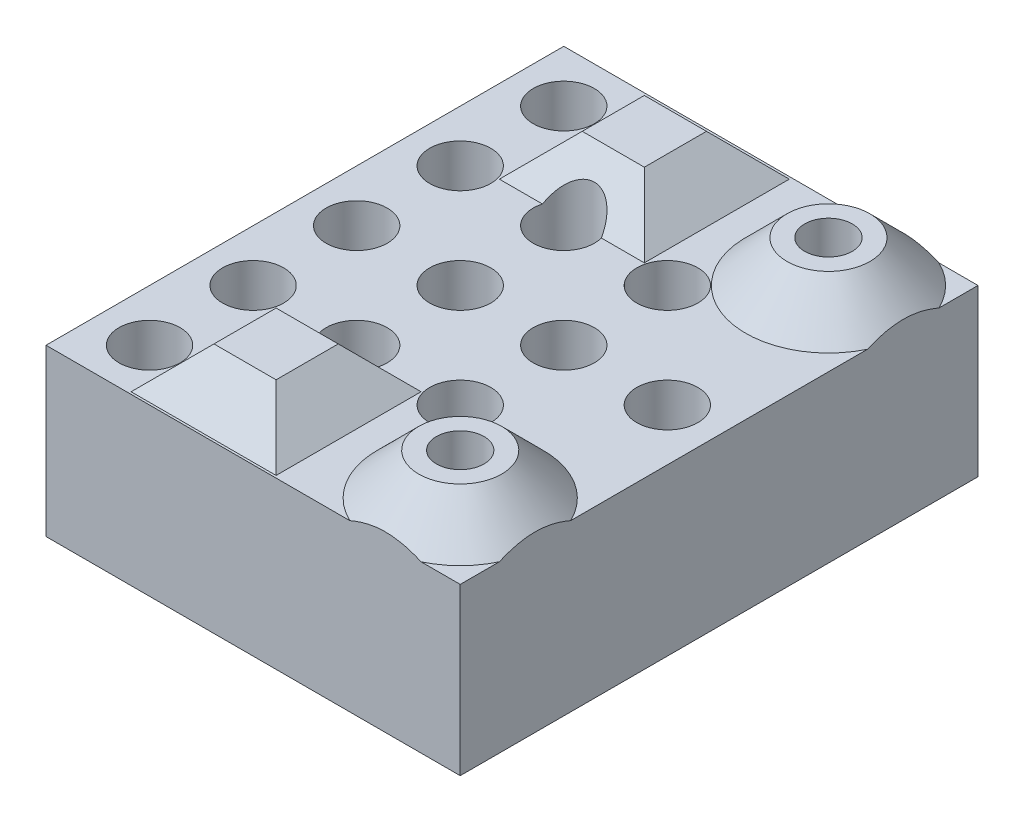
from build123d import *

# Parameters (mm, degrees)
SKETCH1_W                = 25
SKETCH1_H                = 25
BOSS_EXTRUDE1_DEPTH      = 8
SKETCH2_R                = 0.95
CUT_EXTRUDE1_DEPTH       = 20.403607912
BOSS_EXTRUDE2_START      = 2
SKETCH3_R                = 2
SKETCH3_R_2              = 0.95
BOSS_EXTRUDE2_DEPTH      = 2
SKETCH6_W                = 3
SKETCH6_H                = 3
BOSS_EXTRUDE3_DEPTH      = 2
CHAMFER1_SIZE            = 2
SKETCH4_R                = 1.475
CUT_EXTRUDE2_DEPTH       = 21.310096012
LPATTERN1_COUNT          = 5
LPATTERN1_PITCH          = 5
LPATTERN1_COUNT_DIR2     = 3
LPATTERN1_PITCH_DIR2     = 5
MIRROR1_COPY_1_SKETCH_R  = 1.475
MIRROR1_COPY_1_DEPTH     = 21.310096012
MIRROR1_COPY_2_SKETCH_R  = 1.475
MIRROR1_COPY_2_DEPTH     = 21.310096012
MIRROR1_COPY_3_SKETCH_R  = 1.475
MIRROR1_COPY_3_DEPTH     = 21.310096012
MIRROR1_COPY_4_SKETCH_R  = 1.475
MIRROR1_COPY_4_DEPTH     = 21.310096012
MIRROR1_COPY_5_SKETCH_R  = 1.475
MIRROR1_COPY_5_DEPTH     = 21.310096012
MIRROR1_COPY_6_SKETCH_R  = 1.475
MIRROR1_COPY_6_DEPTH     = 21.310096012
MIRROR1_COPY_7_SKETCH_R  = 1.475
MIRROR1_COPY_7_DEPTH     = 21.310096012
MIRROR1_COPY_8_SKETCH_R  = 1.475
MIRROR1_COPY_8_DEPTH     = 21.310096012
MIRROR1_COPY_9_SKETCH_R  = 1.475
MIRROR1_COPY_9_DEPTH     = 21.310096012
MIRROR1_COPY_10_SKETCH_R = 1.475
MIRROR1_COPY_10_DEPTH    = 21.310096012
MIRROR1_COPY_11_SKETCH_R = 1.475
MIRROR1_COPY_11_DEPTH    = 21.310096012
SKETCH5_R                = 1.15
CUT_EXTRUDE3_DEPTH       = 2
SKETCH7_W                = 5
SKETCH7_H                = 25
CUT_EXTRUDE4_DEPTH       = 20.403607912


with BuildPart() as part:
    # Sketch1 → Boss-Extrude1 (new body)
    with BuildSketch(Plane(origin=(0, 0, 0), x_dir=(1, 0, 0), z_dir=(0, 1, 0))):
        Rectangle(SKETCH1_W, SKETCH1_H)
    extrude(amount=BOSS_EXTRUDE1_DEPTH)

    # Sketch2 → Cut-Extrude1 (cut, through all)
    with BuildSketch(Plane(origin=(0, 8, 0), x_dir=(1, 0, 0), z_dir=(0, 1, 0))):
        with Locations(Location((8.89, -8.89, 0), (0, 0, 270))):
            Circle(SKETCH2_R)
        with Locations(Location((8.89, 8.89, 0), (0, 0, 270))):
            Circle(SKETCH2_R)
    extrude(amount=-CUT_EXTRUDE1_DEPTH, mode=Mode.SUBTRACT)

    # Sketch3 → Boss-Extrude2 (add)
    # profile 1 of 2: a face of its own
    with BuildSketch(Plane(origin=(0, 8, 0), x_dir=(1, 0, 0), z_dir=(0, 1, 0)).offset(BOSS_EXTRUDE2_START)):
        with Locations(Location((8.89, 8.89, 0), (0, 0, 270))):
            Circle(SKETCH3_R)
        with Locations(Location((8.89, 8.89, 0), (0, 0, 270))):
            Circle(SKETCH3_R_2, mode=Mode.SUBTRACT)
    # profile 2 of 2: a face of its own
    with BuildSketch(Plane(origin=(0, 8, 0), x_dir=(1, 0, 0), z_dir=(0, 1, 0)).offset(BOSS_EXTRUDE2_START)):
        with Locations(Location((8.89, -8.89, 0), (0, 0, 270))):
            Circle(SKETCH3_R)
        with Locations(Location((8.89, -8.89, 0), (0, 0, 270))):
            Circle(SKETCH3_R_2, mode=Mode.SUBTRACT)
    extrude(amount=-BOSS_EXTRUDE2_DEPTH)

    # Sketch6 → Boss-Extrude3 (add)
    with BuildSketch(Plane(origin=(0, 8, 0), x_dir=(1, 0, 0), z_dir=(0, 1, 0))):
        with Locations((0, 8.89)):
            Rectangle(SKETCH6_W, SKETCH6_H)
        with Locations((0, -8.89)):
            Rectangle(SKETCH6_W, SKETCH6_H)
    extrude(amount=BOSS_EXTRUDE3_DEPTH)

    # Chamfer1
    # the kernel refuses this chamfer: 2 mm, written as the material it adds along each edge
    with BuildSketch(Plane(origin=(8.89, 8, -8.89), x_dir=(0, 0, 1), z_dir=(-1, 0, 0))) as chamfer1_piece_1_section:
        Polygon((2 + CHAMFER1_SIZE, 0), (2, CHAMFER1_SIZE), (2, 0), align=None)
    chamfer1_piece_1 = revolve(axis=Axis((8.89, 8, -8.89), (0, 1, 0)), mode=Mode.PRIVATE)
    chamfer1_piece_1 = split(chamfer1_piece_1, bisect_by=Plane(origin=(8.89, 8.948307197, -12.5), z_dir=(0, 0, 1)), keep=Keep.TOP, mode=Mode.PRIVATE)
    chamfer1_piece_1 = split(chamfer1_piece_1, bisect_by=Plane(origin=(12.5, 8.948307197, -11.894875739), z_dir=(-1, 0, 0)), keep=Keep.TOP, mode=Mode.PRIVATE)
    chamfer1_piece_1 = split(chamfer1_piece_1, bisect_by=Plane(origin=(8.89, 10, -11.894875739), z_dir=(0, -1, 0)), keep=Keep.TOP, mode=Mode.PRIVATE)
    add(chamfer1_piece_1)
    with BuildSketch(Plane(origin=(8.89, 8, 8.89), x_dir=(0, 0, 1), z_dir=(-1, 0, 0))) as chamfer1_piece_2_section:
        Polygon((2 + CHAMFER1_SIZE, 0), (2, CHAMFER1_SIZE), (2, 0), align=None)
    chamfer1_piece_2 = revolve(axis=Axis((8.89, 8, 8.89), (0, 1, 0)), mode=Mode.PRIVATE)
    chamfer1_piece_2 = split(chamfer1_piece_2, bisect_by=Plane(origin=(12.5, 8.948307195, 5.885124263), z_dir=(-1, 0, 0)), keep=Keep.TOP, mode=Mode.PRIVATE)
    chamfer1_piece_2 = split(chamfer1_piece_2, bisect_by=Plane(origin=(8.89, 8.948307195, 12.5), z_dir=(0, 0, -1)), keep=Keep.TOP, mode=Mode.PRIVATE)
    chamfer1_piece_2 = split(chamfer1_piece_2, bisect_by=Plane(origin=(8.89, 10, 5.885124263), z_dir=(0, -1, 0)), keep=Keep.TOP, mode=Mode.PRIVATE)
    add(chamfer1_piece_2)
    with BuildSketch(Plane(origin=(-1.5, 8, 7.39), x_dir=(0, -0.027495876610586487, -0.9996219169112968), z_dir=(1, 0, 0))) as chamfer1_piece_3_section:
        Polygon((CHAMFER1_SIZE * 0.999621916911, CHAMFER1_SIZE * 0.0274958766106), (-CHAMFER1_SIZE * 0.0274958766106, CHAMFER1_SIZE * 0.999621916911), (0, 0), align=None)
    chamfer1_piece_3 = extrude(amount=3, mode=Mode.PRIVATE)
    chamfer1_piece_3 = split(chamfer1_piece_3, bisect_by=Plane(origin=(0, 10, 6.729191691), z_dir=(0, -1, 0)), keep=Keep.TOP, mode=Mode.PRIVATE)
    add(chamfer1_piece_3)
    with BuildSketch(Plane(origin=(1.5, 8, 7.39), x_dir=(0.9996219169112968, -0.027495876610586494, 0), z_dir=(0, 0, 1))) as chamfer1_piece_4_section:
        Polygon((CHAMFER1_SIZE * 0.999621916911, CHAMFER1_SIZE * 0.0274958766106), (-CHAMFER1_SIZE * 0.0274958766106, CHAMFER1_SIZE * 0.999621916911), (0, 0), align=None)
    chamfer1_piece_4 = extrude(amount=3, mode=Mode.PRIVATE)
    chamfer1_piece_4 = split(chamfer1_piece_4, bisect_by=Plane(origin=(2.160808309, 10, 8.89), z_dir=(0, -1, 0)), keep=Keep.TOP, mode=Mode.PRIVATE)
    add(chamfer1_piece_4)
    with BuildSketch(Plane(origin=(1.5, 8, 10.39), x_dir=(0, -0.027495876610586487, 0.9996219169112968), z_dir=(-1, 0, 0))) as chamfer1_piece_5_section:
        Polygon((CHAMFER1_SIZE * 0.999621916911, CHAMFER1_SIZE * 0.0274958766106), (-CHAMFER1_SIZE * 0.0274958766106, CHAMFER1_SIZE * 0.999621916911), (0, 0), align=None)
    chamfer1_piece_5 = extrude(amount=3, mode=Mode.PRIVATE)
    chamfer1_piece_5 = split(chamfer1_piece_5, bisect_by=Plane(origin=(0, 10, 11.050808309), z_dir=(0, -1, 0)), keep=Keep.TOP, mode=Mode.PRIVATE)
    add(chamfer1_piece_5)
    with BuildSketch(Plane(origin=(-1.5, 8, 10.39), x_dir=(-0.9996219169112968, -0.027495876610586497, 0), z_dir=(0, 0, -1))) as chamfer1_piece_6_section:
        Polygon((CHAMFER1_SIZE * 0.999621916911, CHAMFER1_SIZE * 0.0274958766106), (-CHAMFER1_SIZE * 0.0274958766106, CHAMFER1_SIZE * 0.999621916911), (0, 0), align=None)
    chamfer1_piece_6 = extrude(amount=3, mode=Mode.PRIVATE)
    chamfer1_piece_6 = split(chamfer1_piece_6, bisect_by=Plane(origin=(-2.160808309, 10, 8.89), z_dir=(0, -1, 0)), keep=Keep.TOP, mode=Mode.PRIVATE)
    add(chamfer1_piece_6)
    with BuildSketch(Plane(origin=(1.5, 8, -10.39), x_dir=(0.9996219169112968, -0.027495876610586494, 0), z_dir=(0, 0, 1))) as chamfer1_piece_7_section:
        Polygon((CHAMFER1_SIZE * 0.999621916911, CHAMFER1_SIZE * 0.0274958766106), (-CHAMFER1_SIZE * 0.0274958766106, CHAMFER1_SIZE * 0.999621916911), (0, 0), align=None)
    chamfer1_piece_7 = extrude(amount=3, mode=Mode.PRIVATE)
    chamfer1_piece_7 = split(chamfer1_piece_7, bisect_by=Plane(origin=(2.160808309, 10, -8.89), z_dir=(0, -1, 0)), keep=Keep.TOP, mode=Mode.PRIVATE)
    add(chamfer1_piece_7)
    with BuildSketch(Plane(origin=(-1.5, 8, -10.39), x_dir=(0, -0.027495876610586487, -0.9996219169112968), z_dir=(1, 0, 0))) as chamfer1_piece_8_section:
        Polygon((CHAMFER1_SIZE * 0.999621916911, CHAMFER1_SIZE * 0.0274958766106), (-CHAMFER1_SIZE * 0.0274958766106, CHAMFER1_SIZE * 0.999621916911), (0, 0), align=None)
    chamfer1_piece_8 = extrude(amount=3, mode=Mode.PRIVATE)
    chamfer1_piece_8 = split(chamfer1_piece_8, bisect_by=Plane(origin=(0, 10, -11.050808309), z_dir=(0, -1, 0)), keep=Keep.TOP, mode=Mode.PRIVATE)
    add(chamfer1_piece_8)
    with BuildSketch(Plane(origin=(-1.5, 8, -7.39), x_dir=(-0.9996219169112968, -0.027495876610586494, 0), z_dir=(0, 0, -1))) as chamfer1_piece_9_section:
        Polygon((CHAMFER1_SIZE * 0.999621916911, CHAMFER1_SIZE * 0.0274958766106), (-CHAMFER1_SIZE * 0.0274958766106, CHAMFER1_SIZE * 0.999621916911), (0, 0), align=None)
    chamfer1_piece_9 = extrude(amount=3, mode=Mode.PRIVATE)
    chamfer1_piece_9 = split(chamfer1_piece_9, bisect_by=Plane(origin=(-2.160808309, 10, -8.89), z_dir=(0, -1, 0)), keep=Keep.TOP, mode=Mode.PRIVATE)
    add(chamfer1_piece_9)
    with BuildSketch(Plane(origin=(1.5, 8, -7.39), x_dir=(0, -0.027495876610586487, 0.9996219169112968), z_dir=(-1, 0, 0))) as chamfer1_piece_10_section:
        Polygon((CHAMFER1_SIZE * 0.999621916911, CHAMFER1_SIZE * 0.0274958766106), (-CHAMFER1_SIZE * 0.0274958766106, CHAMFER1_SIZE * 0.999621916911), (0, 0), align=None)
    chamfer1_piece_10 = extrude(amount=3, mode=Mode.PRIVATE)
    chamfer1_piece_10 = split(chamfer1_piece_10, bisect_by=Plane(origin=(0, 10, -6.729191691), z_dir=(0, -1, 0)), keep=Keep.TOP, mode=Mode.PRIVATE)
    add(chamfer1_piece_10)
    with BuildSketch(Plane(origin=(-6.643365976, 8, 7.39), x_dir=(0, -0.027495876610586487, -0.9996219169112968), z_dir=(1, 0, 0))) as chamfer1_piece_11a_section:
        Polygon((CHAMFER1_SIZE * 0.999621916911, CHAMFER1_SIZE * 0.0274958766106), (-CHAMFER1_SIZE * 0.0274958766106, CHAMFER1_SIZE * 0.999621916911), (0, 0), align=None)
    chamfer1_piece_11a = extrude(amount=8.143365976, mode=Mode.PRIVATE)
    chamfer1_piece_11a = split(chamfer1_piece_11a, bisect_by=Plane(origin=(-1.5, 8.657268668, 6.729191691), z_dir=(-1, 0, 0)), keep=Keep.TOP, mode=Mode.PRIVATE)
    chamfer1_piece_11a = split(chamfer1_piece_11a, bisect_by=Plane(origin=(-4.071682988, 10, 6.729191691), z_dir=(0, -1, 0)), keep=Keep.TOP, mode=Mode.PRIVATE)
    with BuildSketch(Plane(origin=(-1.5, 8, 10.39), x_dir=(-0.9996219169112968, -0.027495876610586497, 0), z_dir=(0, 0, -1))) as chamfer1_piece_11b_section:
        Polygon((CHAMFER1_SIZE * 0.999621916911, CHAMFER1_SIZE * 0.0274958766106), (-CHAMFER1_SIZE * 0.0274958766106, CHAMFER1_SIZE * 0.999621916911), (0, 0), align=None)
    chamfer1_piece_11b = extrude(amount=8.143365976, mode=Mode.PRIVATE)
    chamfer1_piece_11b = split(chamfer1_piece_11b, bisect_by=Plane(origin=(-2.160808309, 8.657268668, 7.39), z_dir=(0, 0, -1)), keep=Keep.TOP, mode=Mode.PRIVATE)
    chamfer1_piece_11b = split(chamfer1_piece_11b, bisect_by=Plane(origin=(-2.160808309, 10, 4.818317012), z_dir=(0, -1, 0)), keep=Keep.TOP, mode=Mode.PRIVATE)
    chamfer1_piece_11 = chamfer1_piece_11a & chamfer1_piece_11b
    add(chamfer1_piece_11)
    with BuildSketch(Plane(origin=(-1.5, 8, 7.39), x_dir=(0, -0.027495876610586487, -0.9996219169112968), z_dir=(1, 0, 0))) as chamfer1_piece_12a_section:
        Polygon((CHAMFER1_SIZE * 0.999621916911, CHAMFER1_SIZE * 0.0274958766106), (-CHAMFER1_SIZE * 0.0274958766106, CHAMFER1_SIZE * 0.999621916911), (0, 0), align=None)
    chamfer1_piece_12a = extrude(amount=8.143365976, mode=Mode.PRIVATE)
    chamfer1_piece_12a = split(chamfer1_piece_12a, bisect_by=Plane(origin=(1.5, 8.657268668, 6.729191691), z_dir=(1, 0, 0)), keep=Keep.TOP, mode=Mode.PRIVATE)
    chamfer1_piece_12a = split(chamfer1_piece_12a, bisect_by=Plane(origin=(4.071682988, 10, 6.729191691), z_dir=(0, -1, 0)), keep=Keep.TOP, mode=Mode.PRIVATE)
    with BuildSketch(Plane(origin=(1.5, 8, 2.246634024), x_dir=(0.9996219169112968, -0.027495876610586494, 0), z_dir=(0, 0, 1))) as chamfer1_piece_12b_section:
        Polygon((CHAMFER1_SIZE * 0.999621916911, CHAMFER1_SIZE * 0.0274958766106), (-CHAMFER1_SIZE * 0.0274958766106, CHAMFER1_SIZE * 0.999621916911), (0, 0), align=None)
    chamfer1_piece_12b = extrude(amount=8.143365976, mode=Mode.PRIVATE)
    chamfer1_piece_12b = split(chamfer1_piece_12b, bisect_by=Plane(origin=(2.160808309, 8.657268668, 7.39), z_dir=(0, 0, -1)), keep=Keep.TOP, mode=Mode.PRIVATE)
    chamfer1_piece_12b = split(chamfer1_piece_12b, bisect_by=Plane(origin=(2.160808309, 10, 4.818317012), z_dir=(0, -1, 0)), keep=Keep.TOP, mode=Mode.PRIVATE)
    chamfer1_piece_12 = chamfer1_piece_12a & chamfer1_piece_12b
    add(chamfer1_piece_12)
    with BuildSketch(Plane(origin=(1.5, 8, 7.39), x_dir=(0.9996219169112968, -0.027495876610586494, 0), z_dir=(0, 0, 1))) as chamfer1_piece_13a_section:
        Polygon((CHAMFER1_SIZE * 0.999621916911, CHAMFER1_SIZE * 0.0274958766106), (-CHAMFER1_SIZE * 0.0274958766106, CHAMFER1_SIZE * 0.999621916911), (0, 0), align=None)
    chamfer1_piece_13a = extrude(amount=8.143365976, mode=Mode.PRIVATE)
    chamfer1_piece_13a = split(chamfer1_piece_13a, bisect_by=Plane(origin=(2.160808309, 8.657268668, 12.5), z_dir=(0, 0, -1)), keep=Keep.TOP, mode=Mode.PRIVATE)
    chamfer1_piece_13a = split(chamfer1_piece_13a, bisect_by=Plane(origin=(2.160808309, 8.657268668, 10.39), z_dir=(0, 0, 1)), keep=Keep.TOP, mode=Mode.PRIVATE)
    chamfer1_piece_13a = split(chamfer1_piece_13a, bisect_by=Plane(origin=(2.160808309, 10, 11.445), z_dir=(0, -1, 0)), keep=Keep.TOP, mode=Mode.PRIVATE)
    with BuildSketch(Plane(origin=(6.643365976, 8, 10.39), x_dir=(0, -0.027495876610586487, 0.9996219169112968), z_dir=(-1, 0, 0))) as chamfer1_piece_13b_section:
        Polygon((CHAMFER1_SIZE * 0.999621916911, CHAMFER1_SIZE * 0.0274958766106), (-CHAMFER1_SIZE * 0.0274958766106, CHAMFER1_SIZE * 0.999621916911), (0, 0), align=None)
    chamfer1_piece_13b = extrude(amount=8.143365976, mode=Mode.PRIVATE)
    chamfer1_piece_13b = split(chamfer1_piece_13b, bisect_by=Plane(origin=(1.5, 8.657268668, 11.050808309), z_dir=(1, 0, 0)), keep=Keep.TOP, mode=Mode.PRIVATE)
    chamfer1_piece_13b = split(chamfer1_piece_13b, bisect_by=Plane(origin=(4.071682988, 10, 11.050808309), z_dir=(0, -1, 0)), keep=Keep.TOP, mode=Mode.PRIVATE)
    chamfer1_piece_13 = chamfer1_piece_13a & chamfer1_piece_13b
    add(chamfer1_piece_13)
    with BuildSketch(Plane(origin=(1.5, 8, 10.39), x_dir=(0, -0.027495876610586487, 0.9996219169112968), z_dir=(-1, 0, 0))) as chamfer1_piece_14a_section:
        Polygon((CHAMFER1_SIZE * 0.999621916911, CHAMFER1_SIZE * 0.0274958766106), (-CHAMFER1_SIZE * 0.0274958766106, CHAMFER1_SIZE * 0.999621916911), (0, 0), align=None)
    chamfer1_piece_14a = extrude(amount=8.143365976, mode=Mode.PRIVATE)
    chamfer1_piece_14a = split(chamfer1_piece_14a, bisect_by=Plane(origin=(-1.5, 8.657268668, 11.050808309), z_dir=(-1, 0, 0)), keep=Keep.TOP, mode=Mode.PRIVATE)
    chamfer1_piece_14a = split(chamfer1_piece_14a, bisect_by=Plane(origin=(-4.071682988, 10, 11.050808309), z_dir=(0, -1, 0)), keep=Keep.TOP, mode=Mode.PRIVATE)
    with BuildSketch(Plane(origin=(-1.5, 8, 15.533365976), x_dir=(-0.9996219169112968, -0.027495876610586487, 0), z_dir=(0, 0, -1))) as chamfer1_piece_14b_section:
        Polygon((CHAMFER1_SIZE * 0.999621916911, CHAMFER1_SIZE * 0.0274958766106), (-CHAMFER1_SIZE * 0.0274958766106, CHAMFER1_SIZE * 0.999621916911), (0, 0), align=None)
    chamfer1_piece_14b = extrude(amount=8.143365976, mode=Mode.PRIVATE)
    chamfer1_piece_14b = split(chamfer1_piece_14b, bisect_by=Plane(origin=(-2.160808309, 8.657268668, 12.5), z_dir=(0, 0, -1)), keep=Keep.TOP, mode=Mode.PRIVATE)
    chamfer1_piece_14b = split(chamfer1_piece_14b, bisect_by=Plane(origin=(-2.160808309, 8.657268668, 10.39), z_dir=(0, 0, 1)), keep=Keep.TOP, mode=Mode.PRIVATE)
    chamfer1_piece_14b = split(chamfer1_piece_14b, bisect_by=Plane(origin=(-2.160808309, 10, 11.445), z_dir=(0, -1, 0)), keep=Keep.TOP, mode=Mode.PRIVATE)
    chamfer1_piece_14 = chamfer1_piece_14a & chamfer1_piece_14b
    add(chamfer1_piece_14)
    with BuildSketch(Plane(origin=(-1.5, 8, -10.39), x_dir=(0, -0.027495876610586487, -0.9996219169112968), z_dir=(1, 0, 0))) as chamfer1_piece_15a_section:
        Polygon((CHAMFER1_SIZE * 0.999621916911, CHAMFER1_SIZE * 0.0274958766106), (-CHAMFER1_SIZE * 0.0274958766106, CHAMFER1_SIZE * 0.999621916911), (0, 0), align=None)
    chamfer1_piece_15a = extrude(amount=8.143365976, mode=Mode.PRIVATE)
    chamfer1_piece_15a = split(chamfer1_piece_15a, bisect_by=Plane(origin=(1.5, 8.657268668, -11.050808309), z_dir=(1, 0, 0)), keep=Keep.TOP, mode=Mode.PRIVATE)
    chamfer1_piece_15a = split(chamfer1_piece_15a, bisect_by=Plane(origin=(4.071682988, 10, -11.050808309), z_dir=(0, -1, 0)), keep=Keep.TOP, mode=Mode.PRIVATE)
    with BuildSketch(Plane(origin=(1.5, 8, -15.533365976), x_dir=(0.9996219169112968, -0.027495876610586497, 0), z_dir=(0, 0, 1))) as chamfer1_piece_15b_section:
        Polygon((CHAMFER1_SIZE * 0.999621916911, CHAMFER1_SIZE * 0.0274958766106), (-CHAMFER1_SIZE * 0.0274958766106, CHAMFER1_SIZE * 0.999621916911), (0, 0), align=None)
    chamfer1_piece_15b = extrude(amount=8.143365976, mode=Mode.PRIVATE)
    chamfer1_piece_15b = split(chamfer1_piece_15b, bisect_by=Plane(origin=(2.160808309, 8.657268668, -12.5), z_dir=(0, 0, 1)), keep=Keep.TOP, mode=Mode.PRIVATE)
    chamfer1_piece_15b = split(chamfer1_piece_15b, bisect_by=Plane(origin=(2.160808309, 8.657268668, -10.39), z_dir=(0, 0, -1)), keep=Keep.TOP, mode=Mode.PRIVATE)
    chamfer1_piece_15b = split(chamfer1_piece_15b, bisect_by=Plane(origin=(2.160808309, 10, -11.445), z_dir=(0, -1, 0)), keep=Keep.TOP, mode=Mode.PRIVATE)
    chamfer1_piece_15 = chamfer1_piece_15a & chamfer1_piece_15b
    add(chamfer1_piece_15)
    with BuildSketch(Plane(origin=(1.5, 8, -10.39), x_dir=(0.9996219169112968, -0.027495876610586494, 0), z_dir=(0, 0, 1))) as chamfer1_piece_16a_section:
        Polygon((CHAMFER1_SIZE * 0.999621916911, CHAMFER1_SIZE * 0.0274958766106), (-CHAMFER1_SIZE * 0.0274958766106, CHAMFER1_SIZE * 0.999621916911), (0, 0), align=None)
    chamfer1_piece_16a = extrude(amount=8.143365976, mode=Mode.PRIVATE)
    chamfer1_piece_16a = split(chamfer1_piece_16a, bisect_by=Plane(origin=(2.160808309, 8.657268668, -7.39), z_dir=(0, 0, 1)), keep=Keep.TOP, mode=Mode.PRIVATE)
    chamfer1_piece_16a = split(chamfer1_piece_16a, bisect_by=Plane(origin=(2.160808309, 10, -4.818317012), z_dir=(0, -1, 0)), keep=Keep.TOP, mode=Mode.PRIVATE)
    with BuildSketch(Plane(origin=(6.643365976, 8, -7.39), x_dir=(0, -0.027495876610586487, 0.9996219169112968), z_dir=(-1, 0, 0))) as chamfer1_piece_16b_section:
        Polygon((CHAMFER1_SIZE * 0.999621916911, CHAMFER1_SIZE * 0.0274958766106), (-CHAMFER1_SIZE * 0.0274958766106, CHAMFER1_SIZE * 0.999621916911), (0, 0), align=None)
    chamfer1_piece_16b = extrude(amount=8.143365976, mode=Mode.PRIVATE)
    chamfer1_piece_16b = split(chamfer1_piece_16b, bisect_by=Plane(origin=(1.5, 8.657268668, -6.729191691), z_dir=(1, 0, 0)), keep=Keep.TOP, mode=Mode.PRIVATE)
    chamfer1_piece_16b = split(chamfer1_piece_16b, bisect_by=Plane(origin=(4.071682988, 10, -6.729191691), z_dir=(0, -1, 0)), keep=Keep.TOP, mode=Mode.PRIVATE)
    chamfer1_piece_16 = chamfer1_piece_16a & chamfer1_piece_16b
    add(chamfer1_piece_16)
    with BuildSketch(Plane(origin=(-6.643365976, 8, -10.39), x_dir=(0, -0.027495876610586487, -0.9996219169112968), z_dir=(1, 0, 0))) as chamfer1_piece_17a_section:
        Polygon((CHAMFER1_SIZE * 0.999621916911, CHAMFER1_SIZE * 0.0274958766106), (-CHAMFER1_SIZE * 0.0274958766106, CHAMFER1_SIZE * 0.999621916911), (0, 0), align=None)
    chamfer1_piece_17a = extrude(amount=8.143365976, mode=Mode.PRIVATE)
    chamfer1_piece_17a = split(chamfer1_piece_17a, bisect_by=Plane(origin=(-1.5, 8.657268668, -11.050808309), z_dir=(-1, 0, 0)), keep=Keep.TOP, mode=Mode.PRIVATE)
    chamfer1_piece_17a = split(chamfer1_piece_17a, bisect_by=Plane(origin=(-4.071682988, 10, -11.050808309), z_dir=(0, -1, 0)), keep=Keep.TOP, mode=Mode.PRIVATE)
    with BuildSketch(Plane(origin=(-1.5, 8, -7.39), x_dir=(-0.9996219169112968, -0.027495876610586494, 0), z_dir=(0, 0, -1))) as chamfer1_piece_17b_section:
        Polygon((CHAMFER1_SIZE * 0.999621916911, CHAMFER1_SIZE * 0.0274958766106), (-CHAMFER1_SIZE * 0.0274958766106, CHAMFER1_SIZE * 0.999621916911), (0, 0), align=None)
    chamfer1_piece_17b = extrude(amount=8.143365976, mode=Mode.PRIVATE)
    chamfer1_piece_17b = split(chamfer1_piece_17b, bisect_by=Plane(origin=(-2.160808309, 8.657268668, -12.5), z_dir=(0, 0, 1)), keep=Keep.TOP, mode=Mode.PRIVATE)
    chamfer1_piece_17b = split(chamfer1_piece_17b, bisect_by=Plane(origin=(-2.160808309, 8.657268668, -10.39), z_dir=(0, 0, -1)), keep=Keep.TOP, mode=Mode.PRIVATE)
    chamfer1_piece_17b = split(chamfer1_piece_17b, bisect_by=Plane(origin=(-2.160808309, 10, -11.445), z_dir=(0, -1, 0)), keep=Keep.TOP, mode=Mode.PRIVATE)
    chamfer1_piece_17 = chamfer1_piece_17a & chamfer1_piece_17b
    add(chamfer1_piece_17)
    with BuildSketch(Plane(origin=(1.5, 8, -7.39), x_dir=(0, -0.027495876610586487, 0.9996219169112968), z_dir=(-1, 0, 0))) as chamfer1_piece_18a_section:
        Polygon((CHAMFER1_SIZE * 0.999621916911, CHAMFER1_SIZE * 0.0274958766106), (-CHAMFER1_SIZE * 0.0274958766106, CHAMFER1_SIZE * 0.999621916911), (0, 0), align=None)
    chamfer1_piece_18a = extrude(amount=8.143365976, mode=Mode.PRIVATE)
    chamfer1_piece_18a = split(chamfer1_piece_18a, bisect_by=Plane(origin=(-1.5, 8.657268668, -6.729191691), z_dir=(-1, 0, 0)), keep=Keep.TOP, mode=Mode.PRIVATE)
    chamfer1_piece_18a = split(chamfer1_piece_18a, bisect_by=Plane(origin=(-4.071682988, 10, -6.729191691), z_dir=(0, -1, 0)), keep=Keep.TOP, mode=Mode.PRIVATE)
    with BuildSketch(Plane(origin=(-1.5, 8, -2.246634024), x_dir=(-0.9996219169112968, -0.027495876610586487, 0), z_dir=(0, 0, -1))) as chamfer1_piece_18b_section:
        Polygon((CHAMFER1_SIZE * 0.999621916911, CHAMFER1_SIZE * 0.0274958766106), (-CHAMFER1_SIZE * 0.0274958766106, CHAMFER1_SIZE * 0.999621916911), (0, 0), align=None)
    chamfer1_piece_18b = extrude(amount=8.143365976, mode=Mode.PRIVATE)
    chamfer1_piece_18b = split(chamfer1_piece_18b, bisect_by=Plane(origin=(-2.160808309, 8.657268668, -7.39), z_dir=(0, 0, 1)), keep=Keep.TOP, mode=Mode.PRIVATE)
    chamfer1_piece_18b = split(chamfer1_piece_18b, bisect_by=Plane(origin=(-2.160808309, 10, -4.818317012), z_dir=(0, -1, 0)), keep=Keep.TOP, mode=Mode.PRIVATE)
    chamfer1_piece_18 = chamfer1_piece_18a & chamfer1_piece_18b
    add(chamfer1_piece_18)

    # Sketch4 → Cut-Extrude2 (cut, through all)
    with BuildSketch(Plane.XZ):
        with Locations(Location((-10, 0, 0), (0, 0, 270))):
            Circle(SKETCH4_R)
    cut_extrude2 = extrude(amount=-CUT_EXTRUDE2_DEPTH, mode=Mode.SUBTRACT)

    # LPattern1: Cut-Extrude2 5 × 3, 4 skipped
    with Locations(*[(i * LPATTERN1_PITCH, 0, j * LPATTERN1_PITCH_DIR2) for i in range(LPATTERN1_COUNT) for j in range(LPATTERN1_COUNT_DIR2) if (i, j) not in ((0, 0), (2, 2), (3, 2), (4, 1), (4, 2))]):
        add(cut_extrude2, mode=Mode.SUBTRACT)

    # Mirror1 copy 1 sketch → Mirror1 copy 1 (cut, through all)
    with BuildSketch(Plane(origin=(0, 0, -5), x_dir=(1, 0, 0), z_dir=(0, -1, 0))):
        with Locations((-10, 0)):
            Circle(MIRROR1_COPY_1_SKETCH_R)
    extrude(amount=-MIRROR1_COPY_1_DEPTH, mode=Mode.SUBTRACT)

    # Mirror1 copy 2 sketch → Mirror1 copy 2 (cut, through all)
    with BuildSketch(Plane(origin=(0, 0, -10), x_dir=(1, 0, 0), z_dir=(0, -1, 0))):
        with Locations((-10, 0)):
            Circle(MIRROR1_COPY_2_SKETCH_R)
    extrude(amount=-MIRROR1_COPY_2_DEPTH, mode=Mode.SUBTRACT)

    # Mirror1 copy 3 sketch → Mirror1 copy 3 (cut, through all)
    with BuildSketch(Plane(origin=(5, 0, 0), x_dir=(1, 0, 0), z_dir=(0, -1, 0))):
        with Locations((-10, 0)):
            Circle(MIRROR1_COPY_3_SKETCH_R)
    extrude(amount=-MIRROR1_COPY_3_DEPTH, mode=Mode.SUBTRACT)

    # Mirror1 copy 4 sketch → Mirror1 copy 4 (cut, through all)
    with BuildSketch(Plane(origin=(5, 0, -5), x_dir=(1, 0, 0), z_dir=(0, -1, 0))):
        with Locations((-10, 0)):
            Circle(MIRROR1_COPY_4_SKETCH_R)
    extrude(amount=-MIRROR1_COPY_4_DEPTH, mode=Mode.SUBTRACT)

    # Mirror1 copy 5 sketch → Mirror1 copy 5 (cut, through all)
    with BuildSketch(Plane(origin=(5, 0, -10), x_dir=(1, 0, 0), z_dir=(0, -1, 0))):
        with Locations((-10, 0)):
            Circle(MIRROR1_COPY_5_SKETCH_R)
    extrude(amount=-MIRROR1_COPY_5_DEPTH, mode=Mode.SUBTRACT)

    # Mirror1 copy 6 sketch → Mirror1 copy 6 (cut, through all)
    with BuildSketch(Plane(origin=(10, 0, 0), x_dir=(1, 0, 0), z_dir=(0, -1, 0))):
        with Locations((-10, 0)):
            Circle(MIRROR1_COPY_6_SKETCH_R)
    extrude(amount=-MIRROR1_COPY_6_DEPTH, mode=Mode.SUBTRACT)

    # Mirror1 copy 7 sketch → Mirror1 copy 7 (cut, through all)
    with BuildSketch(Plane(origin=(10, 0, -5), x_dir=(1, 0, 0), z_dir=(0, -1, 0))):
        with Locations((-10, 0)):
            Circle(MIRROR1_COPY_7_SKETCH_R)
    extrude(amount=-MIRROR1_COPY_7_DEPTH, mode=Mode.SUBTRACT)

    # Mirror1 copy 8 sketch → Mirror1 copy 8 (cut, through all)
    with BuildSketch(Plane(origin=(15, 0, 0), x_dir=(1, 0, 0), z_dir=(0, -1, 0))):
        with Locations((-10, 0)):
            Circle(MIRROR1_COPY_8_SKETCH_R)
    extrude(amount=-MIRROR1_COPY_8_DEPTH, mode=Mode.SUBTRACT)

    # Mirror1 copy 9 sketch → Mirror1 copy 9 (cut, through all)
    with BuildSketch(Plane(origin=(15, 0, -5), x_dir=(1, 0, 0), z_dir=(0, -1, 0))):
        with Locations((-10, 0)):
            Circle(MIRROR1_COPY_9_SKETCH_R)
    extrude(amount=-MIRROR1_COPY_9_DEPTH, mode=Mode.SUBTRACT)

    # Mirror1 copy 10 sketch → Mirror1 copy 10 (cut, through all)
    with BuildSketch(Plane(origin=(20, 0, 0), x_dir=(1, 0, 0), z_dir=(0, -1, 0))):
        with Locations((-10, 0)):
            Circle(MIRROR1_COPY_10_SKETCH_R)
    extrude(amount=-MIRROR1_COPY_10_DEPTH, mode=Mode.SUBTRACT)

    # Mirror1 copy 11 sketch → Mirror1 copy 11 (cut, through all)
    with BuildSketch(Plane.XZ):
        with Locations((-10, 0)):
            Circle(MIRROR1_COPY_11_SKETCH_R)
    extrude(amount=-MIRROR1_COPY_11_DEPTH, mode=Mode.SUBTRACT)

    # Sketch5 → Cut-Extrude3 (cut)
    with BuildSketch(Plane(origin=(0, 10, 0), x_dir=(1, 0, 0), z_dir=(0, 1, 0))):
        with Locations(Location((8.89, 8.89, 0), (0, 0, 270))):
            Circle(SKETCH5_R)
        with Locations(Location((8.89, -8.89, 0), (0, 0, 270))):
            Circle(SKETCH5_R)
    extrude(amount=-CUT_EXTRUDE3_DEPTH, mode=Mode.SUBTRACT)

    # Sketch7 → Cut-Extrude4 (cut, through all)
    with BuildSketch(Plane(origin=(0, 8, 0), x_dir=(1, 0, 0), z_dir=(0, 1, 0))):
        with Locations((-10, 0)):
            Rectangle(SKETCH7_W, SKETCH7_H)
    extrude(amount=-CUT_EXTRUDE4_DEPTH, mode=Mode.SUBTRACT)


solid = part.part
